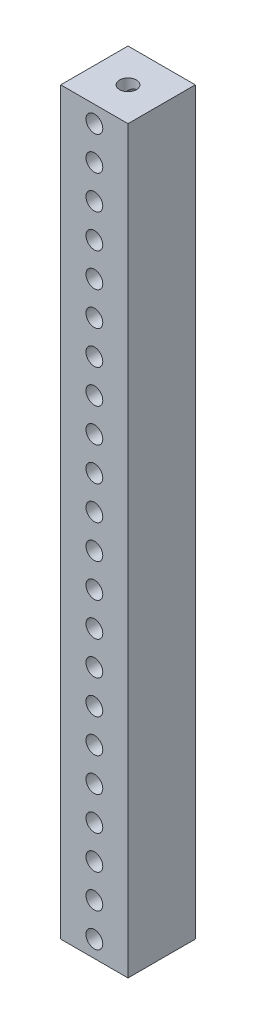
from build123d import *

# Parameters (mm, degrees)
SKETCH2_W           = 20
SKETCH2_H           = 20
SKETCH2_R           = 2.5
BOSS_EXTRUDE1_DEPTH = 220
SKETCH3_R           = 2.5
CUT_EXTRUDE1_DEPTH  = 222.133443875
LPATTERN1_COUNT     = 20
LPATTERN1_PITCH     = 10
SKETCH4_R           = 2.5
CUT_EXTRUDE2_DEPTH  = 222.133443875


with BuildPart() as part:
    # Sketch2 → Boss-Extrude1 (new body)
    with BuildSketch(Plane(origin=(0, 0, 0), x_dir=(1, 0, 0), z_dir=(0, 1, 0))):
        Rectangle(SKETCH2_W, SKETCH2_H)
        Circle(SKETCH2_R, mode=Mode.SUBTRACT)
    extrude(amount=BOSS_EXTRUDE1_DEPTH)

    # Sketch3 → Cut-Extrude1 (cut, through all)
    with BuildSketch(Plane.XY.offset(10)):
        with Locations((0, 5)):
            Circle(SKETCH3_R)
    cut_extrude1 = extrude(amount=-CUT_EXTRUDE1_DEPTH, mode=Mode.SUBTRACT)

    # LPattern1: Cut-Extrude1 ×20
    with Locations(*[(0, i * LPATTERN1_PITCH, 0) for i in range(1, LPATTERN1_COUNT)]):
        add(cut_extrude1, mode=Mode.SUBTRACT)

    # Sketch4 → Cut-Extrude2 (cut, through all)
    with BuildSketch(Plane.XY.offset(10)):
        with Locations((0, 215)):
            Circle(SKETCH4_R)
        with Locations((0, 205)):
            Circle(SKETCH4_R)
    extrude(amount=-CUT_EXTRUDE2_DEPTH, mode=Mode.SUBTRACT)


solid = part.part
